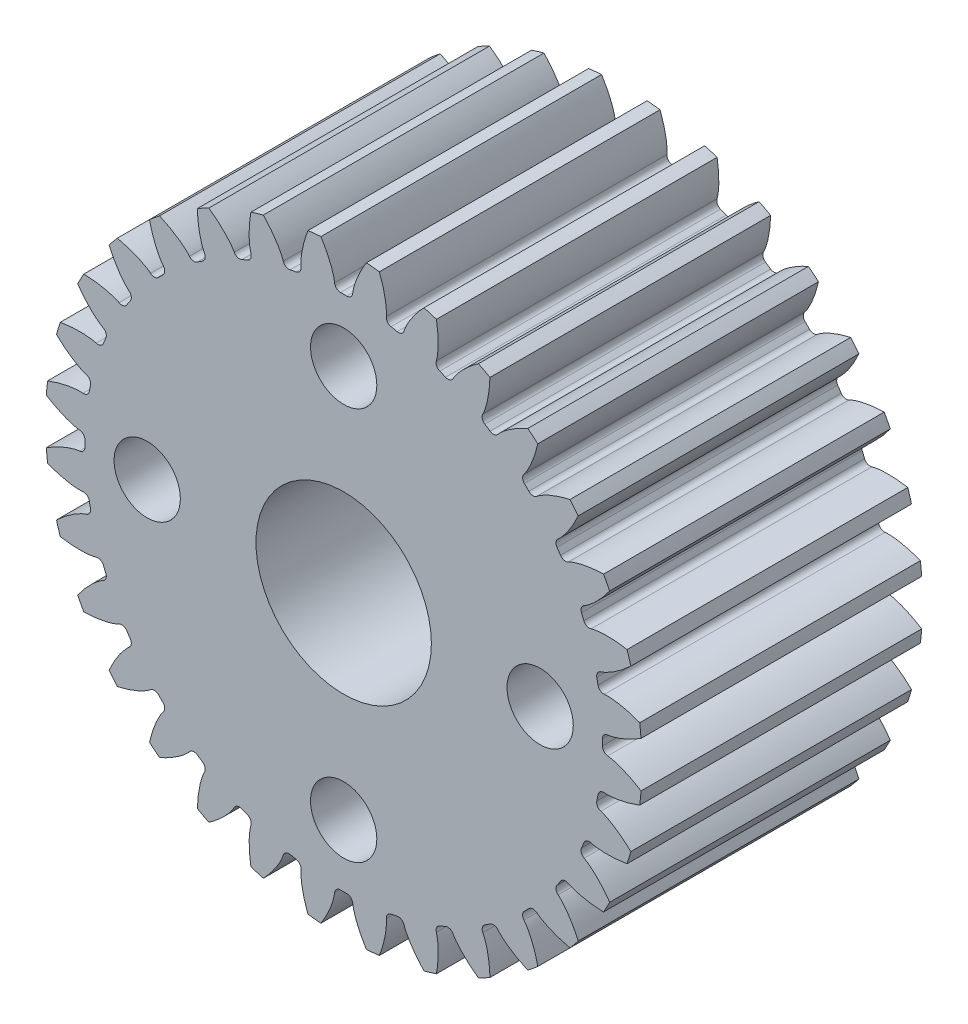
from build123d import *

# Parameters (mm, degrees)
BOSS_EXTRUDE1_DEPTH         = 6.35
BOSS_EXTRUDE1_DEPTH_BACK    = 6.35
SKETCH3_R                   = 13.49375
CUT_EXTRUDE1_DEPTH          = 21.111814392
FILLET1_R                   = 0.266307122
CIRPATTERN1_COUNT           = 32
FILLET1_OF_CIRPATTERN1_R    = 0.266307122
F_5_16_0_3125_DOWEL_HOLE1_D = 7.9375
F_3_0MM_DOWEL_HOLE1_D       = 3
CIRPATTERN2_COUNT           = 4


with BuildPart() as part:
    # Sketch3 → Boss-Extrude1 (new, two sides: drawn at the far end of the back side and taken through both)
    with BuildSketch(Plane.XY.offset(-BOSS_EXTRUDE1_DEPTH_BACK)):
        Circle(SKETCH3_R)
    extrude(amount=BOSS_EXTRUDE1_DEPTH + BOSS_EXTRUDE1_DEPTH_BACK)

    # Sketch4 → Cut-Extrude1 (cut, symmetric)
    with BuildSketch(Plane.XY):
        with BuildLine():
            Line((11.700973008, 0.400130236), (11.927124601, 0.407863789))
            add(Edge.make_bspline(
                [(11.927124601, 0.407863789), (11.929579035, 0.407975164), (11.936459719, 0.408372432), (11.949453928, 0.409458708), (11.970633276, 0.411707238), (11.997580433, 0.415271814), (12.032359073, 0.420682145), (12.073256546, 0.428088152), (12.118117887, 0.437308422), (12.166825815, 0.448506047), (12.215324181, 0.460708159), (12.263608675, 0.473839328), (12.31161736, 0.487784555), (12.369657206, 0.505697652), (12.439089085, 0.528595827), (12.519987041, 0.55742504), (12.611419198, 0.592556574), (12.704239144, 0.630961693), (12.795265419, 0.670887614), (12.886856591, 0.713678454), (12.975206011, 0.756817117), (13.066558717, 0.804130374), (13.150672039, 0.849077329), (13.244423789, 0.902201185), (13.319942342, 0.945880824), (13.397530739, 0.993305143), (13.435230514, 1.016726553), (13.45447058, 1.02883938)],
                knots=[0, 0, 0, 0, 0, 0.005376749, 0.015083688, 0.02853182, 0.04661014, 0.064854849, 0.092110526, 0.119476176, 0.146842496, 0.174208854, 0.201574956, 0.228941013, 0.256307345, 0.307035032, 0.361767352, 0.416499661, 0.471231937, 0.525964282, 0.580696616, 0.635428982, 0.690161387, 0.744893688, 0.799626082, 0.854358407, 0.909090914, 0.909090914, 0.909090914, 0.909090914, 0.909090914], degree=4))
            ThreePointArc((13.45447058, 1.02883938), (13.49375, 0), (13.45447058, -1.02883938))
            add(Edge.make_bspline(
                [(11.927124601, -0.407863789), (11.929579035, -0.407975164), (11.936459719, -0.408372432), (11.949453928, -0.409458708), (11.970633276, -0.411707238), (11.997580433, -0.415271814), (12.032359073, -0.420682145), (12.073256546, -0.428088152), (12.118117887, -0.437308422), (12.166825815, -0.448506047), (12.215324181, -0.460708159), (12.263608675, -0.473839328), (12.31161736, -0.487784555), (12.369657206, -0.505697652), (12.439089085, -0.528595827), (12.519987041, -0.55742504), (12.611419198, -0.592556574), (12.704239144, -0.630961693), (12.795265419, -0.670887614), (12.886856591, -0.713678454), (12.975206011, -0.756817117), (13.066558717, -0.804130374), (13.150672039, -0.849077329), (13.244423789, -0.902201185), (13.319942342, -0.945880824), (13.397530739, -0.993305143), (13.435230514, -1.016726553), (13.45447058, -1.02883938)],
                knots=[0, 0, 0, 0, 0, 0.005376749, 0.015083688, 0.02853182, 0.04661014, 0.064854849, 0.092110526, 0.119476176, 0.146842496, 0.174208854, 0.201574956, 0.228941013, 0.256307345, 0.307035032, 0.361767352, 0.416499661, 0.471231937, 0.525964282, 0.580696616, 0.635428982, 0.690161387, 0.744893688, 0.799626082, 0.854358407, 0.909090914, 0.909090914, 0.909090914, 0.909090914, 0.909090914], degree=4))
            Line((11.927124601, -0.407863789), (11.700973008, -0.400130236))
            ThreePointArc((11.700973008, -0.400130236), (11.7078125, 0), (11.700973008, 0.400130236))
        make_face()
    cut_extrude1 = extrude(amount=CUT_EXTRUDE1_DEPTH, both=True, mode=Mode.SUBTRACT)

    # Fillet1
    fillet1_edges = [part.edges().sort_by_distance(p)[0] for p in [
        (11.700973008, -0.400130236, 0),
        (11.700973008, 0.400130236, 0),
    ]]
    fillet(fillet1_edges, radius=FILLET1_R)

    # CirPattern1: Cut-Extrude1 ×32 about axis
    cirpattern1_axis = Axis((0, 0, 6.35), (0, 0, -1))
    for i in range(1, CIRPATTERN1_COUNT):
        add(cut_extrude1.rotate(cirpattern1_axis, i * 360 / CIRPATTERN1_COUNT), mode=Mode.SUBTRACT)

    # Fillet1 of CirPattern1
    fillet1_of_cirpattern1_edges = [part.edges().sort_by_distance(p)[0] for p in [
        (11.398080556, -2.675188438, 0),
        (11.554203629, -1.890304746, 0),
        (10.65716626, -4.847440648, 0),
        (10.963412684, -4.108096377, 0),
        (9.506703042, -6.833408433, 0),
        (9.951303939, -6.168016168, 0),
        (7.990902557, -8.556772163, 0),
        (8.556772163, -7.990902557, 0),
        (6.168016168, -9.951303939, 0),
        (6.833408433, -9.506703042, 0),
        (4.108096377, -10.963412684, 0),
        (4.847440648, -10.65716626, 0),
        (1.890304746, -11.554203629, 0),
        (2.675188438, -11.398080556, 0),
        (-0.400130236, -11.700973008, 0),
        (0.400130236, -11.700973008, 0),
        (-2.675188438, -11.398080556, 0),
        (-1.890304746, -11.554203629, 0),
        (-4.847440648, -10.65716626, 0),
        (-4.108096377, -10.963412684, 0),
        (-6.833408433, -9.506703042, 0),
        (-6.168016168, -9.951303939, 0),
        (-8.556772163, -7.990902557, 0),
        (-7.990902557, -8.556772163, 0),
        (-9.951303939, -6.168016168, 0),
        (-9.506703042, -6.833408433, 0),
        (-10.963412684, -4.108096377, 0),
        (-10.65716626, -4.847440648, 0),
        (-11.554203629, -1.890304746, 0),
        (-11.398080556, -2.675188438, 0),
        (-11.700973008, 0.400130236, 0),
        (-11.700973008, -0.400130236, 0),
        (-11.398080556, 2.675188438, 0),
        (-11.554203629, 1.890304746, 0),
        (-10.65716626, 4.847440648, 0),
        (-10.963412684, 4.108096377, 0),
        (-9.506703042, 6.833408433, 0),
        (-9.951303939, 6.168016168, 0),
        (-7.990902557, 8.556772163, 0),
        (-8.556772163, 7.990902557, 0),
        (-6.168016168, 9.951303939, 0),
        (-6.833408433, 9.506703042, 0),
        (-4.108096377, 10.963412684, 0),
        (-4.847440648, 10.65716626, 0),
        (-1.890304746, 11.554203629, 0),
        (-2.675188438, 11.398080556, 0),
        (0.400130236, 11.700973008, 0),
        (-0.400130236, 11.700973008, 0),
        (2.675188438, 11.398080556, 0),
        (1.890304746, 11.554203629, 0),
        (4.847440648, 10.65716626, 0),
        (4.108096377, 10.963412684, 0),
        (6.833408433, 9.506703042, 0),
        (6.168016168, 9.951303939, 0),
        (8.556772163, 7.990902557, 0),
        (7.990902557, 8.556772163, 0),
        (9.951303939, 6.168016168, 0),
        (9.506703042, 6.833408433, 0),
        (10.963412684, 4.108096377, 0),
        (10.65716626, 4.847440648, 0),
        (11.554203629, 1.890304746, 0),
        (11.398080556, 2.675188438, 0),
    ]]
    fillet(fillet1_of_cirpattern1_edges, radius=FILLET1_OF_CIRPATTERN1_R)

    # 5/16 (0.3125) Dowel Hole1 (through all)
    with Locations(Plane.XY.offset(6.35)):
        with Locations((0, 0)):
            Hole(F_5_16_0_3125_DOWEL_HOLE1_D / 2)

    # Ø3.0mm Dowel Hole1 (through all)
    with Locations(Plane.XY.offset(6.35)):
        with Locations((0, 0), (0, 8.89)):
            f_3_0mm_dowel_hole1 = Hole(F_3_0MM_DOWEL_HOLE1_D / 2)

    # CirPattern2: Ø3.0mm Dowel Hole1 ×4 about axis
    cirpattern2_axis = Axis((0, 0, 0), (0, 0, 1))
    for i in range(1, CIRPATTERN2_COUNT):
        add(f_3_0mm_dowel_hole1.rotate(cirpattern2_axis, i * 360 / CIRPATTERN2_COUNT), mode=Mode.SUBTRACT)


solid = part.part
